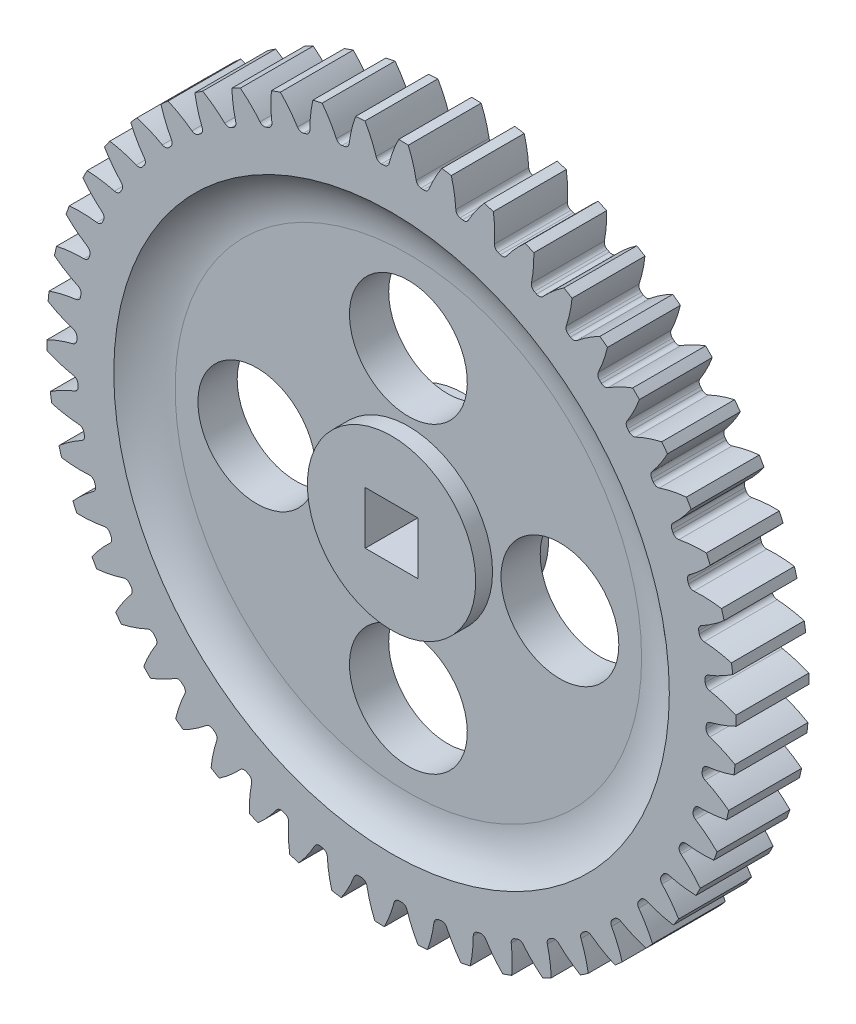
from build123d import *

# Parameters (mm, degrees)
SKETCH3_R          = 26
GEARBODY_DEPTH     = 5.499999998
TOOTHCUT_DEPTH     = 38.17862289
CIRPATTERN1_COUNT  = 50
BOREDIA_R          = 1.5875
BORE_DEPTH         = 12700
SKETCH4_R          = 20.955
SKETCH4_R_2        = 6.35
CUT_EXTRUDE1_DEPTH = 1.27
CUT_EXTRUDE2_START = -1.27
SKETCH5_R          = 20.955
SKETCH5_R_2        = 6.35
CUT_EXTRUDE2_DEPTH = 1.27
FILLET2_R          = 5.08
SKETCH6_R          = 4.445
CUT_EXTRUDE3_DEPTH = 38.006183625
CIRPATTERN2_COUNT  = 4
SKETCH8_W          = 3.97
SKETCH8_H          = 3.97
CUT_EXTRUDE7_DEPTH = 38.172768615


with BuildPart() as part:
    # Sketch3 → gearBody (new body)
    with BuildSketch(Plane.XY):
        with Locations(Location((0, 0, 0), (0, 0, 180))):
            Circle(SKETCH3_R)
    extrude(amount=GEARBODY_DEPTH)

    # Sketch2 → toothCut (cut, through all)
    with BuildSketch(Plane.XY):
        with BuildLine():
            ThreePointArc((23.731397627, -0.91938419), (23.734871798, -0.824840213), (23.737969314, -0.730283147))
            ThreePointArc((23.737969314, -0.730283147), (23.82750333, -0.488292555), (24.044845282, -0.349230473))
            ThreePointArc((24.044845282, -0.349230473), (27.21103988, 1.092273746), (29.658276585, 3.564874635))
            ThreePointArc((29.658276585, 3.564874635), (29.853732217, -1.037484384), (29.339249323, -5.615171442))
            ThreePointArc((29.339249323, -5.615171442), (27.069566222, -2.978646974), (24.011080321, -1.320821097))
            ThreePointArc((24.011080321, -1.320821097), (23.803916493, -1.167006485), (23.731397627, -0.91938419))
        make_face()
    toothcut = extrude(amount=TOOTHCUT_DEPTH, mode=Mode.SUBTRACT)

    # CirPattern1: toothCut ×50 about axis
    cirpattern1_axis = Axis((0, 0, 0), (0, 0, 1))
    for i in range(1, CIRPATTERN1_COUNT):
        add(toothcut.rotate(cirpattern1_axis, i * 360 / CIRPATTERN1_COUNT), mode=Mode.SUBTRACT)

    # boreDia → bore (cut, symmetric)
    with BuildSketch(Plane.XY):
        Circle(BOREDIA_R)
    extrude(amount=BORE_DEPTH, both=True, mode=Mode.SUBTRACT)

    # Sketch4 → Cut-Extrude1 (cut)
    with BuildSketch(Plane.XY.offset(5.499999998)):
        Circle(SKETCH4_R)
        Circle(SKETCH4_R_2, mode=Mode.SUBTRACT)
    extrude(amount=-CUT_EXTRUDE1_DEPTH, mode=Mode.SUBTRACT)

    # Sketch5 → Cut-Extrude2 (cut)
    with BuildSketch(Plane(origin=(0, 0, 0), x_dir=(-1, 0, 0), z_dir=(0, 0, -1)).offset(CUT_EXTRUDE2_START)):
        with Locations(Location((0, 0, 0), (0, 0, 180))):
            Circle(SKETCH5_R)
        with Locations(Location((0, 0, 0), (0, 0, 180))):
            Circle(SKETCH5_R_2, mode=Mode.SUBTRACT)
    extrude(amount=CUT_EXTRUDE2_DEPTH, mode=Mode.SUBTRACT)

    # Fillet2
    # the kernel refuses this fillet: 5.08 mm, written as the material it adds along each edge
    with BuildSketch(Plane(origin=(0, 0, 4.229999998), x_dir=(1, 0, 0), z_dir=(0, -1, 0))) as fillet2_piece_1:
        with BuildLine():
            CenterArc((17.594895835, 5.08), FILLET2_R, 270, 41.409622109)
            Line((17.594895835, 0), (17.594895835, -0.1016))
            Line((17.594895835, -0.1016), (20.955, -0.1016))
            Line((20.955, -0.1016), (21.0566, 0))
            ThreePointArc((21.0566, 0), (21.0566, 0.635), (21.022202083, 1.1938))
            Line((21.022202083, 1.1938), (20.955, 1.27))
        make_face()
    revolve(axis=Axis((0, 0, 4.229999998), (0, 0, 1)))
    with BuildSketch(Plane(origin=(0, 0, 1.27), x_dir=(1, 0, 0), z_dir=(0, 1, 0))) as fillet2_piece_2:
        with BuildLine():
            CenterArc((17.594895835, 5.08), FILLET2_R, 270, 41.409622109)
            Line((17.594895835, 0), (17.594895835, -0.1016))
            Line((17.594895835, -0.1016), (20.955, -0.1016))
            Line((20.955, -0.1016), (21.0566, 0))
            ThreePointArc((21.0566, 0), (21.0566, 0.635), (21.022202083, 1.1938))
            Line((21.022202083, 1.1938), (20.955, 1.27))
        make_face()
    revolve(axis=Axis((0, 0, 1.27), (0, 0, -1)))

    # Sketch6 → Cut-Extrude3 (cut, through all)
    with BuildSketch(Plane.XY.offset(4.229999998)):
        with Locations((11.43, 0)):
            Circle(SKETCH6_R)
    cut_extrude3 = extrude(amount=-CUT_EXTRUDE3_DEPTH, mode=Mode.SUBTRACT)

    # CirPattern2: Cut-Extrude3 ×4 about axis
    cirpattern2_axis = Axis((0, 0, 0), (0, 0, 1))
    for i in range(1, CIRPATTERN2_COUNT):
        add(cut_extrude3.rotate(cirpattern2_axis, i * 360 / CIRPATTERN2_COUNT), mode=Mode.SUBTRACT)

    # Sketch8 → Cut-Extrude7 (cut, through all)
    with BuildSketch(Plane.XY):
        Rectangle(SKETCH8_W, SKETCH8_H)
    extrude(amount=CUT_EXTRUDE7_DEPTH, mode=Mode.SUBTRACT)


solid = part.part
